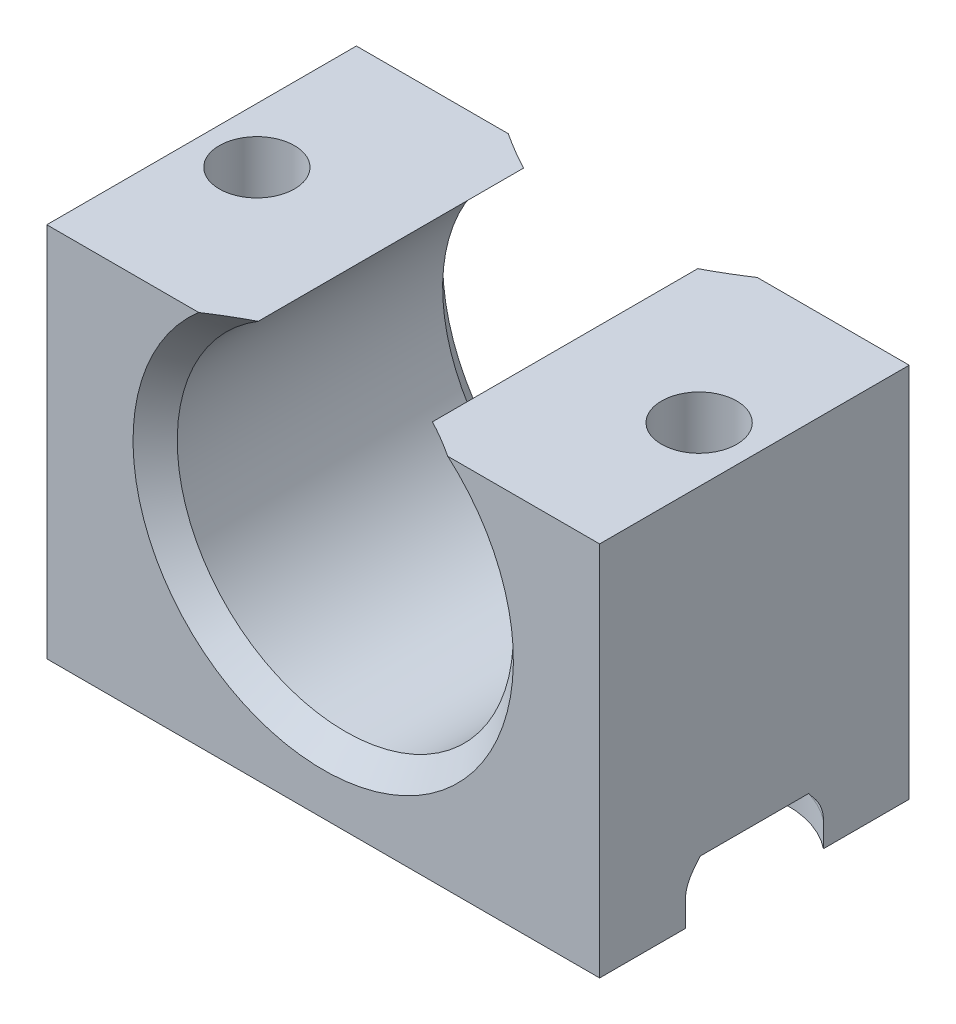
from build123d import *
from OCP.BRepFilletAPI import BRepFilletAPI_MakeChamfer

# Parameters (mm, degrees)
SKETCH1_W                  = 25
SKETCH1_H                  = 14
BOSS_EXTRUDE1_DEPTH        = 17
CUT_EXTRUDE1_START         = -14
CUT_EXTRUDE1_DEPTH         = 14
F_3_4_3_4_DIAMETER_HOLE1_D = 3.4
SKETCH5_R                  = 4
CUT_EXTRUDE2_DEPTH         = 2.5
CHAMFER1_SIZE              = 1
CHAMFER2_SIZE              = 0.5
CHAMFER2_SIZE2             = 0.866025404
FILLET1_R                  = 2


# Read off the part's stored shape, not the designer's step: Cut-Extrude1
with BuildPart() as part:
    # Sketch1 → Boss-Extrude1 (new body)
    with BuildSketch(Plane(origin=(0, 0, 0), x_dir=(1, 0, 0), z_dir=(0, 1, 0))):
        with Locations((12.5, 7)):
            Rectangle(SKETCH1_W, SKETCH1_H)
    extrude(amount=BOSS_EXTRUDE1_DEPTH)

    # Cut-Extrude1 outline → Cut-Extrude1 (cut)
    with BuildSketch(Plane.XY.offset(CUT_EXTRUDE1_START)):
        with BuildLine():
            ThreePointArc((8.561726266, 17), (12.5, 2.9), (16.438273734, 17))
            Line((16.438273734, 17), (8.561726266, 17))
        make_face()
    extrude(amount=CUT_EXTRUDE1_DEPTH, mode=Mode.SUBTRACT)

    # Ø3.4 (3.4) Diameter Hole1 (through all)
    with Locations(Plane(origin=(0, 17, 0), x_dir=(1, 0, 0), z_dir=(0, 1, 0))):
        with Locations((22.5, 7), (2.5, 7)):
            Hole(F_3_4_3_4_DIAMETER_HOLE1_D / 2)

    # Sketch5 → Cut-Extrude2 (cut)
    with BuildSketch(Plane.XZ):
        with Locations((2.5, -7)):
            Circle(SKETCH5_R)
        with Locations((22.5, -7)):
            Circle(SKETCH5_R)
    extrude(amount=-CUT_EXTRUDE2_DEPTH, mode=Mode.SUBTRACT)

    # Chamfer1
    chamfer1_edges = [part.edges().sort_by_distance(p)[0] for p in [
        (12.5, 2.9, 0),
        (12.5, 2.9, -14),
    ]]
    chamfer(chamfer1_edges, length=CHAMFER1_SIZE)

    # Chamfer2: one chamfer whose edges measure the first distance from different faces: ONE call of the kernel's chamfer builder (chamfer() names one face for all edges)
    chamfer2_edges_1 = [part.edges().sort_by_distance(p)[0] for p in [
        (6.5, 2.5, -7),
    ]]
    chamfer2_side_1 = [part.faces().sort_by_distance(p)[0] for p in [
        (0.103077641, 2.5, -7),
    ]]
    chamfer2_edges_2 = [part.edges().sort_by_distance(p)[0] for p in [
        (18.5, 2.5, -7),
    ]]
    chamfer2_side_2 = [part.faces().sort_by_distance(p)[0] for p in [
        (24.896922359, 2.5, -7),
    ]]
    chamfer2 = BRepFilletAPI_MakeChamfer(part.part.solid().wrapped)
    for e in chamfer2_edges_1:
        chamfer2.Add(CHAMFER2_SIZE, CHAMFER2_SIZE2, e.wrapped, chamfer2_side_1[0].wrapped)  # the first distance lies on this face
    for e in chamfer2_edges_2:
        chamfer2.Add(CHAMFER2_SIZE, CHAMFER2_SIZE2, e.wrapped, chamfer2_side_2[0].wrapped)  # the first distance lies on this face
    add(Compound.cast(chamfer2.Shape()), mode=Mode.REPLACE)

    # Fillet1
    fillet1_edges = [part.edges().sort_by_distance(p)[0] for p in [
        (6.5, 1.633974596, -7),
        (18.5, 1.633974596, -7),
    ]]
    fillet(fillet1_edges, radius=FILLET1_R)


solid = part.part
